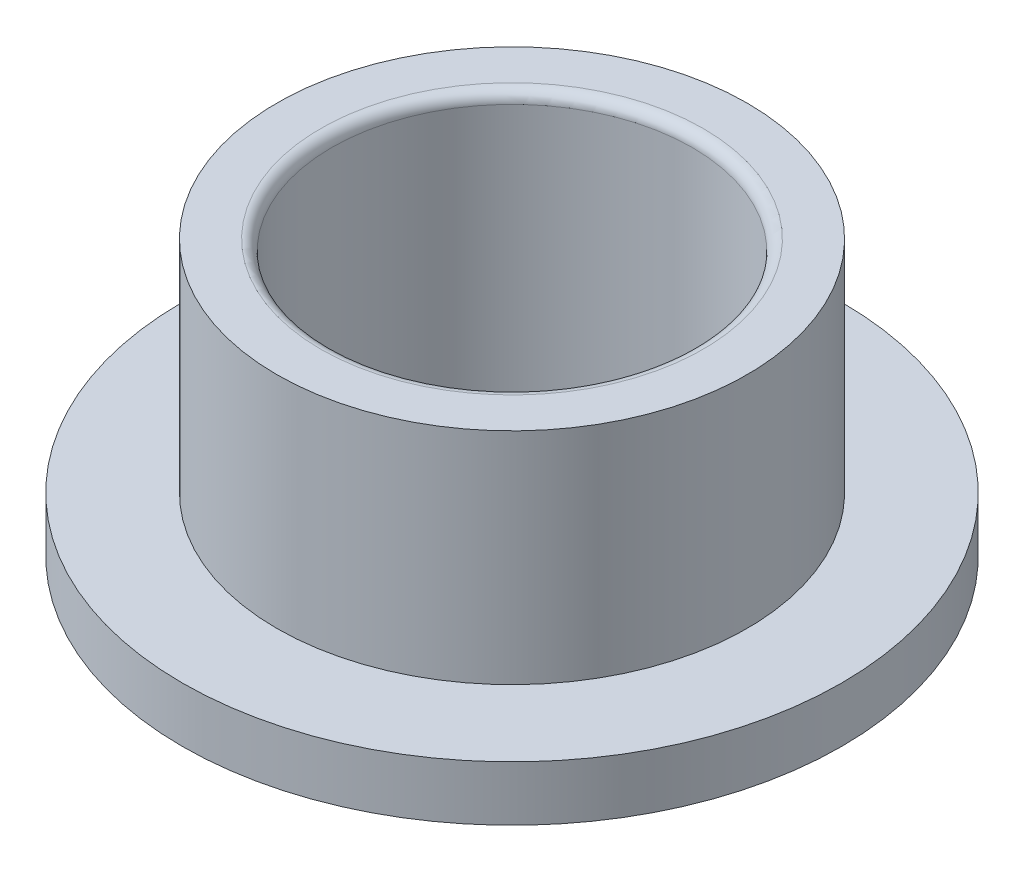
from build123d import *

# Parameters (mm, degrees)
SKETCH1_R           = 21.4
SKETCH1_R_2         = 16.4
BOSS_EXTRUDE1_DEPTH = 20
FILLET1_R           = 1
BOSS_EXTRUDE2_START = 5
SKETCH2_R           = 30
SKETCH2_R_2         = 16.4
BOSS_EXTRUDE2_DEPTH = 5


with BuildPart() as part:
    # Sketch1 → Boss-Extrude1 (new body)
    with BuildSketch(Plane(origin=(0, 0, 0), x_dir=(1, 0, 0), z_dir=(0, 1, 0))):
        Circle(SKETCH1_R)
        Circle(SKETCH1_R_2, mode=Mode.SUBTRACT)
    extrude(amount=BOSS_EXTRUDE1_DEPTH)

    # Fillet1
    fillet1_edges = [part.edges().sort_by_distance(p)[0] for p in [
        (-16.4, 20, 0),
    ]]
    fillet(fillet1_edges, radius=FILLET1_R)

    # Sketch2 → Boss-Extrude2 (add)
    with BuildSketch(Plane.XZ.offset(BOSS_EXTRUDE2_START)):
        Circle(SKETCH2_R)
        Circle(SKETCH2_R_2, mode=Mode.SUBTRACT)
    extrude(amount=-BOSS_EXTRUDE2_DEPTH)


solid = part.part
